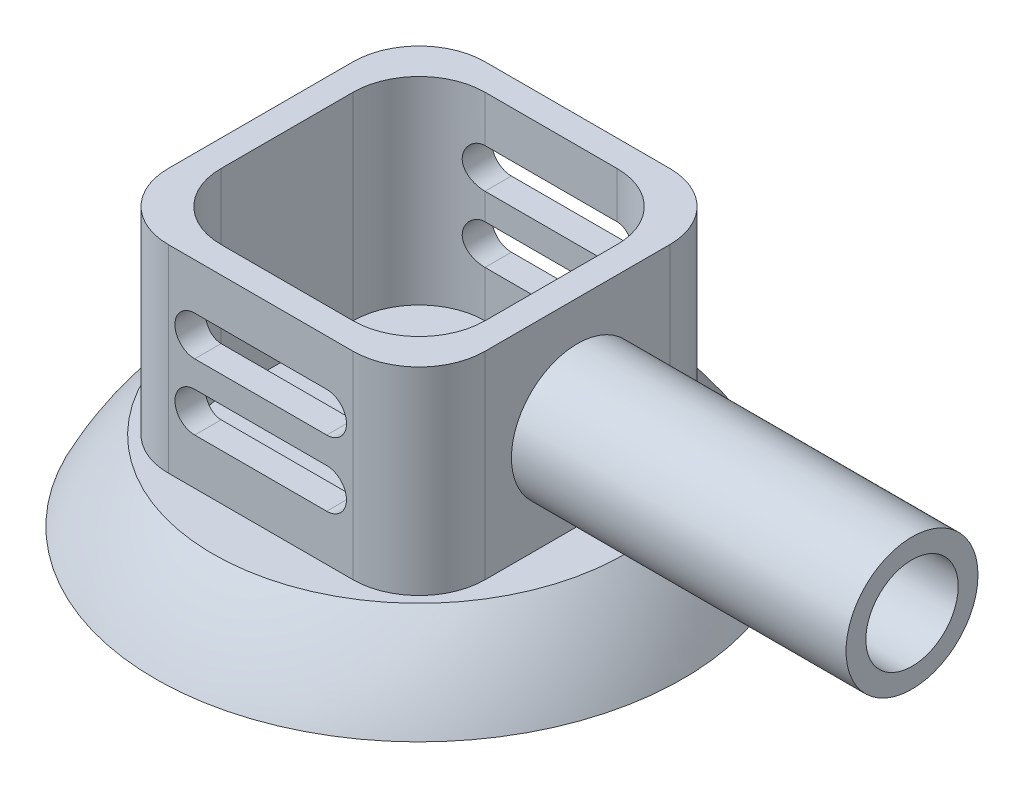
from build123d import *

# Parameters (mm, degrees)
SKETCH_3_R                      = 2.8
CUT_EXTRUDE_2_DEPTH             = 4
SKETCH_8_R                      = 1.5
CUT_EXTRUDE_5_DEPTH             = 4
SKETCH_10_W                     = 24
SKETCH_10_H                     = 24
SKETCH_10_W_2                   = 20
SKETCH_10_H_2                   = 20
EXTRUDE_1_DEPTH                 = 15
EXTRUDE_2_DEPTH                 = 15
EXTRUDE_2_DEPTH_BACK            = 12
SKETCH_7_R                      = 5
SKETCH_7_R_2                    = 3.5
SKETCH_7_5_R                    = 3.5
CUT_EXTRUDE_6_DEPTH             = 12.360679775
FILLET_START                    = 6
FILLET_1_DEPTH                  = 15
FILLET_1_2_DEPTH                = 15
CUT_EXTRUDE_7_REACH             = 55.487
CUT_EXTRUDE_7_DIRECTION_2_DEPTH = 54.486637521


with BuildPart() as part:
    # 草图1 → 旋转1 (revolve)
    with BuildSketch(Plane.XY):
        with BuildLine():
            ThreePointArc((-15.620499352, 6), (-18.061145964, 3.183133409), (-20, 0))
            Line((-20, 0), (0, 0))
            Line((0, 0), (0, 6))
            Line((0, 6), (-15.620499352, 6))
        make_face()
    revolve(axis=Axis((0, 10, 0), (0, -1, 0)))

    # 草图3 → 切除-拉伸2 (cut)
    with BuildSketch(Plane.XZ):
        with Locations(Location((0, 0, 0), (0, 0, 270))):
            Circle(SKETCH_3_R)
    extrude(amount=-CUT_EXTRUDE_2_DEPTH, mode=Mode.SUBTRACT)

    # 草图8 → 切除-拉伸5 (cut)
    with BuildSketch(Plane.XZ.offset(-4)):
        with Locations(Location((0, 0, 0), (0, 0, 270))):
            Circle(SKETCH_8_R)
    extrude(amount=-CUT_EXTRUDE_5_DEPTH, mode=Mode.SUBTRACT)

    # 草图10 → 拉伸-薄壁1 (add)
    with BuildSketch(Plane(origin=(0, 6, 0), x_dir=(1, 0, 0), z_dir=(0, 1, 0))):
        Rectangle(SKETCH_10_W, SKETCH_10_H)
        Rectangle(SKETCH_10_W_2, SKETCH_10_H_2, mode=Mode.SUBTRACT)
    extrude(amount=EXTRUDE_1_DEPTH)

    # 草图7 → 凸台-拉伸2 (add, two sides: drawn at the far end of the back side and taken through both)
    with BuildSketch(Plane(origin=(22.360679775, 0, 0), x_dir=(0, 0, -1), z_dir=(1, 0, 0)).offset(-EXTRUDE_2_DEPTH_BACK)):
        with Locations((0, 13)):
            Circle(SKETCH_7_R)
        with Locations((0, 13)):
            Circle(SKETCH_7_R_2, mode=Mode.SUBTRACT)
    extrude(amount=EXTRUDE_2_DEPTH + EXTRUDE_2_DEPTH_BACK)

    # 草图7<5> → 切除-拉伸6 (cut)
    with BuildSketch(Plane(origin=(22.360679775, 0, 0), x_dir=(0, 0, -1), z_dir=(1, 0, 0))):
        with Locations((0, 13)):
            Circle(SKETCH_7_5_R)
    extrude(amount=-CUT_EXTRUDE_6_DEPTH, mode=Mode.SUBTRACT)

    # 圆角1: read off the stored shape, not the designer's step
    # 圆角1 outline → 圆角1 (cut)
    with BuildSketch(Plane(origin=(0, 0, 0), x_dir=(1, 0, 0), z_dir=(0, 1, 0)).offset(FILLET_START)):
        with BuildLine():
            ThreePointArc((-12, 7), (-10.535533906, 10.535533906), (-7, 12))
            Line((-7, 12), (-12, 12))
            Line((-12, 12), (-12, 7))
        make_face()
        with BuildLine():
            Line((12, 12), (7, 12))
            ThreePointArc((7, 12), (10.535533906, 10.535533906), (12, 7))
            Line((12, 7), (12, 12))
        make_face()
        with BuildLine():
            ThreePointArc((-7, -12), (-10.535533906, -10.535533906), (-12, -7))
            Line((-12, -7), (-12, -12))
            Line((-12, -12), (-7, -12))
        make_face()
        with BuildLine():
            Line((12, -12), (12, -7))
            ThreePointArc((12, -7), (10.535533906, -10.535533906), (7, -12))
            Line((7, -12), (12, -12))
        make_face()
    extrude(amount=FILLET_1_DEPTH, mode=Mode.SUBTRACT)

    # Fillet 1 2 outline → Fillet 1 2 (add)
    with BuildSketch(Plane(origin=(0, 0, 0), x_dir=(1, 0, 0), z_dir=(0, 1, 0)).offset(FILLET_START)):
        with BuildLine():
            Line((10, -10), (10, -5))
            ThreePointArc((10, -5), (8.535533906, -8.535533906), (5, -10))
            Line((5, -10), (10, -10))
        make_face()
        with BuildLine():
            ThreePointArc((5, 10), (8.535533906, 8.535533906), (10, 5))
            Line((10, 5), (10, 10))
            Line((10, 10), (5, 10))
        make_face()
        with BuildLine():
            Line((-10, -10), (-5, -10))
            ThreePointArc((-5, -10), (-8.535533906, -8.535533906), (-10, -5))
            Line((-10, -5), (-10, -10))
        make_face()
        with BuildLine():
            ThreePointArc((-10, 5), (-8.535533906, 8.535533906), (-5, 10))
            Line((-5, 10), (-10, 10))
            Line((-10, 10), (-10, 5))
        make_face()
    extrude(amount=FILLET_1_2_DEPTH)

    # 切除-拉伸7: up to this face of the body (flat: up to its plane)
    cut_extrude_7_end = Plane(part.part.faces().sort_by_distance((0, 13.5, -12))[0])
    # 草图13 → 切除-拉伸7 (cut, up to the picked face)
    with BuildSketch(Plane.XY.offset(12), mode=Mode.PRIVATE) as cut_extrude_7_sk1:
        with BuildLine():
            Line((-5, 17.5), (5, 17.5))
            ThreePointArc((5, 17.5), (6.5, 16), (5, 14.5))
            Line((5, 14.5), (-5, 14.5))
            ThreePointArc((-5, 14.5), (-6.5, 16), (-5, 17.5))
        make_face()
    cut_extrude_7_tool1 = split(extrude(cut_extrude_7_sk1.sketch, amount=-CUT_EXTRUDE_7_REACH, mode=Mode.PRIVATE), bisect_by=cut_extrude_7_end, keep=Keep.BOTH, mode=Mode.PRIVATE)
    # 草图13 → 切除-拉伸7 (cut, up to the picked face)
    with BuildSketch(Plane.XY.offset(12), mode=Mode.PRIVATE) as cut_extrude_7_sk2:
        with BuildLine():
            Line((-5, 12.5), (5, 12.5))
            ThreePointArc((5, 12.5), (6.5, 11), (5, 9.5))
            Line((5, 9.5), (-5, 9.5))
            ThreePointArc((-5, 9.5), (-6.5, 11), (-5, 12.5))
        make_face()
    cut_extrude_7_tool2 = split(extrude(cut_extrude_7_sk2.sketch, amount=-CUT_EXTRUDE_7_REACH, mode=Mode.PRIVATE), bisect_by=cut_extrude_7_end, keep=Keep.BOTH, mode=Mode.PRIVATE)
    add(cut_extrude_7_tool1.solids().sort_by(Axis((0, 16, 12), (0, 0, -1)))[0], mode=Mode.SUBTRACT)
    add(cut_extrude_7_tool2.solids().sort_by(Axis((0, 11, 12), (0, 0, -1)))[0], mode=Mode.SUBTRACT)

    # 草图13 → 切除-拉伸7 direction 2 (cut)
    with BuildSketch(Plane.XY.offset(12)):
        with BuildLine():
            Line((-5, 17.5), (5, 17.5))
            ThreePointArc((5, 17.5), (6.5, 16), (5, 14.5))
            Line((5, 14.5), (-5, 14.5))
            ThreePointArc((-5, 14.5), (-6.5, 16), (-5, 17.5))
        make_face()
        with BuildLine():
            Line((-5, 12.5), (5, 12.5))
            ThreePointArc((5, 12.5), (6.5, 11), (5, 9.5))
            Line((5, 9.5), (-5, 9.5))
            ThreePointArc((-5, 9.5), (-6.5, 11), (-5, 12.5))
        make_face()
    extrude(amount=CUT_EXTRUDE_7_DIRECTION_2_DEPTH, mode=Mode.SUBTRACT)


solid = part.part
